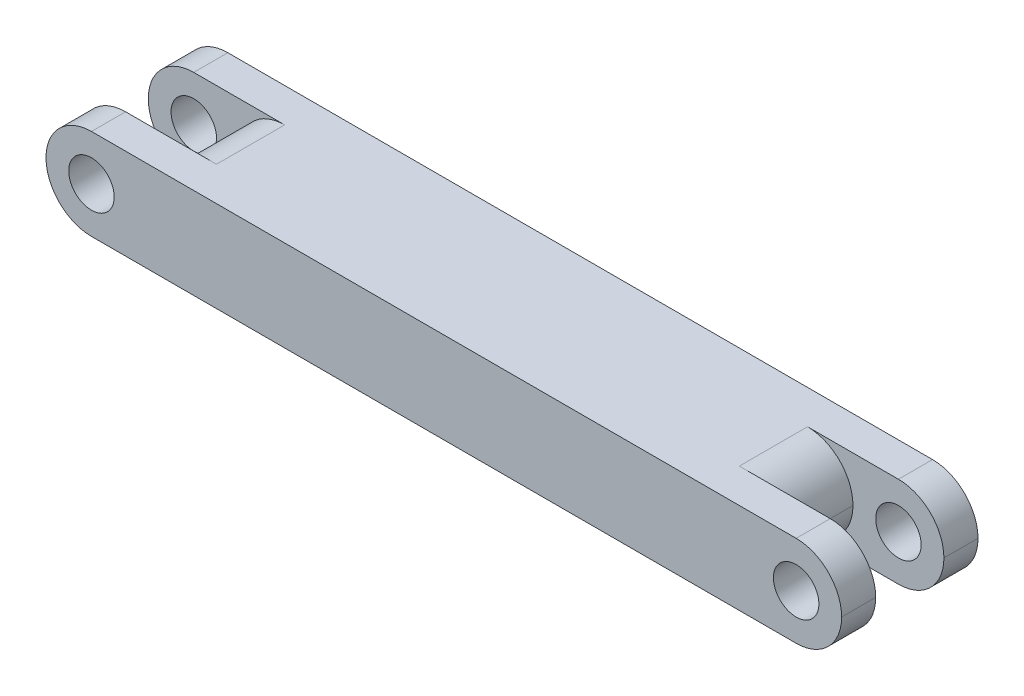
from build123d import *

# Parameters (mm, degrees)
Y_KSEKLIK_EKSTR_ZYON1_DEPTH = 40
KES_EKSTR_ZYON1_REACH       = 191.275
IZIM2_R                     = 10
RADYUS1_R                   = 20


with BuildPart() as part:
    # Çizim1 → Yükseklik-Ekstrüzyon1 (new body)
    with BuildSketch(Plane(origin=(0, 0, 0), x_dir=(1, 0, 0), z_dir=(0, 1, 0))):
        Polygon((-135, -15), (-135, 15), (-175, 15), (-175, 30), (175, 30), (175, 15), (135, 15), (135, -15), (175, -15), (175, -30), (-175, -30), (-175, -15), align=None)
    extrude(amount=-Y_KSEKLIK_EKSTR_ZYON1_DEPTH)

    # Kes-Ekstrüzyon1: up to this face of the body (flat: up to its plane)
    kes_ekstr_zyon1_end = Plane(part.part.faces().sort_by_distance((0, -20, -30))[0])
    # Çizim2 → Kes-Ekstrüzyon1 (cut, up to the picked face)
    with BuildSketch(Plane.XY.offset(30), mode=Mode.PRIVATE) as kes_ekstr_zyon1_sk1:
        with Locations((-155, -20)):
            Circle(IZIM2_R)
    kes_ekstr_zyon1_tool1 = split(extrude(kes_ekstr_zyon1_sk1.sketch, amount=-KES_EKSTR_ZYON1_REACH, mode=Mode.PRIVATE), bisect_by=kes_ekstr_zyon1_end, keep=Keep.BOTH, mode=Mode.PRIVATE)
    # Çizim2 → Kes-Ekstrüzyon1 (cut, up to the picked face)
    with BuildSketch(Plane.XY.offset(30), mode=Mode.PRIVATE) as kes_ekstr_zyon1_sk2:
        with Locations(Location((155, -20, 0), (0, 0, 180))):
            Circle(IZIM2_R)
    kes_ekstr_zyon1_tool2 = split(extrude(kes_ekstr_zyon1_sk2.sketch, amount=-KES_EKSTR_ZYON1_REACH, mode=Mode.PRIVATE), bisect_by=kes_ekstr_zyon1_end, keep=Keep.BOTH, mode=Mode.PRIVATE)
    add(kes_ekstr_zyon1_tool1.solids().sort_by(Axis((-155, -20, 30), (0, 0, -1)))[0], mode=Mode.SUBTRACT)
    add(kes_ekstr_zyon1_tool2.solids().sort_by(Axis((155, -20, 30), (0, 0, -1)))[0], mode=Mode.SUBTRACT)

    # Radyus1
    radyus1_edges = [part.edges().sort_by_distance(p)[0] for p in [
        (135, -40, 0),
        (135, 0, 0),
        (-135, -40, 0),
        (-135, 0, 0),
        (-175, -40, -22.5),
        (-175, 0, -22.5),
        (-175, 0, 22.5),
        (-175, -40, 22.5),
        (175, 0, -22.5),
        (175, -40, -22.5),
        (175, -40, 22.5),
        (175, 0, 22.5),
    ]]
    fillet(radyus1_edges, radius=RADYUS1_R - 0.0001)  # a hair under: the kernel refuses the full size


solid = part.part
